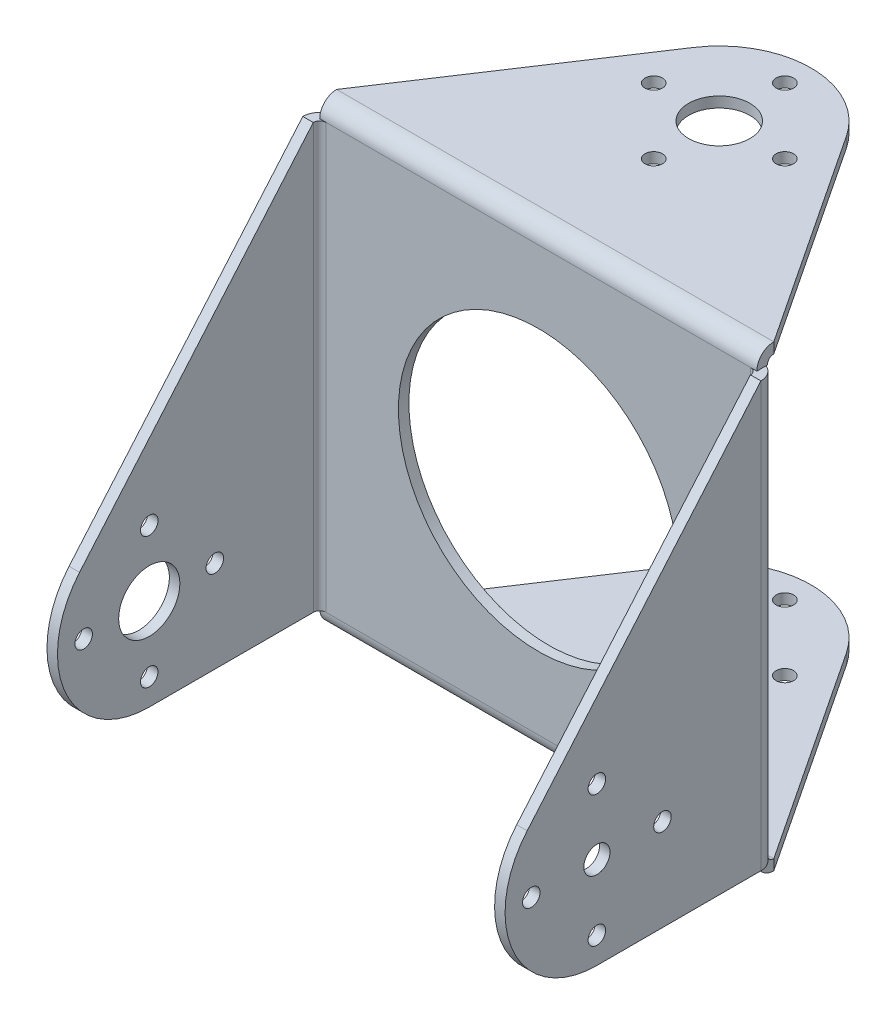
from build123d import *

# Parameters (mm, degrees)
SKETCH_1_W                         = 50
SKETCH_1_H                         = 50
SKETCH_1_R                         = 16
SM_BASE_FLANGE_1_DEPTH             = 1.2
SM_EDGE_FLANGE_1_STRIP_W           = 6.2732
SM_EDGE_FLANGE_1_STRIP_H           = 1.2
SM_EDGE_FLANGE_1_STRIP_CUT_DEPTH   = 50
SM_EDGE_FLANGE_1_STRIP_2_W         = 6.2732
SM_EDGE_FLANGE_1_STRIP_2_H         = 1.2
SM_EDGE_FLANGE_1_STRIP_CUT_2_DEPTH = 50
SM_EDGE_FLANGE_1_DEPTH             = 50
SM_EDGE_FLANGE_1_BEND_DEPTH        = 50
SM_EDGE_FLANGE_2_STRIP_W           = 6.2732
SM_EDGE_FLANGE_2_STRIP_H           = 1.2
SM_EDGE_FLANGE_2_STRIP_CUT_DEPTH   = 48.5268
SM_EDGE_FLANGE_2_STRIP_2_W         = 6.2732
SM_EDGE_FLANGE_2_STRIP_2_H         = 1.2
SM_EDGE_FLANGE_2_STRIP_CUT_2_DEPTH = 48.5268
SM_EDGE_FLANGE_2_DEPTH             = 48.5268
SM_EDGE_FLANGE_2_BEND_DEPTH        = 48.5268
SKETCH_23_R                        = 1
CUT_EXTRUDE_1_DEPTH                = 98
EXTRUDE_START                      = -1.2
SKETCH_30_R                        = 3.5
SKETCH_30_R_2                      = 1.5
EXTRUDE_1_DEPTH                    = 1.2
SKETCH_40_R                        = 1
CUT_EXTRUDE_2_DEPTH                = 67.374995292
SKETCH_40_3_R                      = 1.5
CUT_EXTRUDE_3_DEPTH                = 10
SKETCH_45_R                        = 3.5
CUT_EXTRUDE_4_DEPTH                = 10


# Sheet-metal steps are written as plain solids
with BuildPart() as part:
    # Sketch 1 → 基材-凸緣1 (new body)
    with BuildSketch(Plane.XY):
        Rectangle(SKETCH_1_W, SKETCH_1_H)
        Circle(SKETCH_1_R, mode=Mode.SUBTRACT)
    extrude(amount=-SM_BASE_FLANGE_1_DEPTH)

    # 邊線-凸緣1 strip (across the edge) → 邊線-凸緣1 strip cut (cut)
    with BuildSketch(Plane(origin=(-25, 25, -1.2), x_dir=(0, -1, 0), z_dir=(1, 0, 0))):
        with Locations((-2.4, -0.6)):
            Rectangle(SM_EDGE_FLANGE_1_STRIP_W, SM_EDGE_FLANGE_1_STRIP_H)
    extrude(amount=SM_EDGE_FLANGE_1_STRIP_CUT_DEPTH, mode=Mode.SUBTRACT)

    # 邊線-凸緣1 strip 2 (across the edge) → 邊線-凸緣1 strip cut 2 (cut)
    with BuildSketch(Plane(origin=(25, -25, -1.2), x_dir=(0, 1, 0), z_dir=(-1, 0, 0))):
        with Locations((-2.4, -0.6)):
            Rectangle(SM_EDGE_FLANGE_1_STRIP_2_W, SM_EDGE_FLANGE_1_STRIP_2_H)
    extrude(amount=SM_EDGE_FLANGE_1_STRIP_CUT_2_DEPTH, mode=Mode.SUBTRACT)

    # 邊線-凸緣1 section (across the edge) → 邊線-凸緣1 (add)
    with BuildSketch(Plane(origin=(-25, 25, -1.2), x_dir=(0, -1, 0), z_dir=(1, 0, 0))):
        with BuildLine():
            Line((-1.2, 0.7366), (-1.2, 30))
            Line((-1.2, 30), (0, 30))
            Line((0, 30), (0, 0.7366))
            ThreePointArc((0, 0.7366), (0.215745145, 0.215745145), (0.7366, 0))
            Line((0.7366, 0), (0.7366, -1.2))
            ThreePointArc((0.7366, -1.2), (-0.632782992, -0.632782992), (-1.2, 0.7366))
        make_face()
    extrude(amount=SM_EDGE_FLANGE_1_DEPTH)

    # 邊線-凸緣1 section 2 (across the edge) → 邊線-凸緣1 bend (add)
    with BuildSketch(Plane(origin=(25, -25, -1.2), x_dir=(0, 1, 0), z_dir=(-1, 0, 0))):
        with BuildLine():
            Line((-1.2, 0.7366), (-1.2, 30))
            Line((-1.2, 30), (0, 30))
            Line((0, 30), (0, 0.7366))
            ThreePointArc((0, 0.7366), (0.215745145, 0.215745145), (0.7366, 0))
            Line((0.7366, 0), (0.7366, -1.2))
            ThreePointArc((0.7366, -1.2), (-0.632782992, -0.632782992), (-1.2, 0.7366))
        make_face()
    extrude(amount=SM_EDGE_FLANGE_1_BEND_DEPTH)

    # 邊線-凸緣2 strip (across the edge) → 邊線-凸緣2 strip cut (cut)
    with BuildSketch(Plane(origin=(25, -24.2634, 0), x_dir=(-1, 0, 0), z_dir=(0, 1, 0))):
        with Locations((-2.4, -0.6)):
            Rectangle(SM_EDGE_FLANGE_2_STRIP_W, SM_EDGE_FLANGE_2_STRIP_H)
    extrude(amount=SM_EDGE_FLANGE_2_STRIP_CUT_DEPTH, mode=Mode.SUBTRACT)

    # 邊線-凸緣2 strip 2 (across the edge) → 邊線-凸緣2 strip cut 2 (cut)
    with BuildSketch(Plane(origin=(-25, 24.2634, 0), x_dir=(1, 0, 0), z_dir=(0, -1, 0))):
        with Locations((-2.4, -0.6)):
            Rectangle(SM_EDGE_FLANGE_2_STRIP_2_W, SM_EDGE_FLANGE_2_STRIP_2_H)
    extrude(amount=SM_EDGE_FLANGE_2_STRIP_CUT_2_DEPTH, mode=Mode.SUBTRACT)

    # 邊線-凸緣2 section (across the edge) → 邊線-凸緣2 (add)
    with BuildSketch(Plane(origin=(25, -24.2634, 0), x_dir=(-1, 0, 0), z_dir=(0, 1, 0))):
        with BuildLine():
            Line((-1.2, 0.7366), (-1.2, 30))
            Line((-1.2, 30), (0, 30))
            Line((0, 30), (0, 0.7366))
            ThreePointArc((0, 0.7366), (0.215745145, 0.215745145), (0.7366, 0))
            Line((0.7366, 0), (0.7366, -1.2))
            ThreePointArc((0.7366, -1.2), (-0.632782992, -0.632782992), (-1.2, 0.7366))
        make_face()
    extrude(amount=SM_EDGE_FLANGE_2_DEPTH)

    # 邊線-凸緣2 section 2 (across the edge) → 邊線-凸緣2 bend (add)
    with BuildSketch(Plane(origin=(-25, 24.2634, 0), x_dir=(1, 0, 0), z_dir=(0, -1, 0))):
        with BuildLine():
            Line((-1.2, 0.7366), (-1.2, 30))
            Line((-1.2, 30), (0, 30))
            Line((0, 30), (0, 0.7366))
            ThreePointArc((0, 0.7366), (0.215745145, 0.215745145), (0.7366, 0))
            Line((0.7366, 0), (0.7366, -1.2))
            ThreePointArc((0.7366, -1.2), (-0.632782992, -0.632782992), (-1.2, 0.7366))
        make_face()
    extrude(amount=SM_EDGE_FLANGE_2_BEND_DEPTH)

    # 草圖23 → 除料-伸長1 (cut)
    with BuildSketch(Plane(origin=(0, 26.2, 0), x_dir=(1, 0, 0), z_dir=(0, 1, 0))):
        with BuildLine():
            Line((25, 31.2), (0, 31.2))
            ThreePointArc((0, 31.2), (4.971280899, 29.948587256), (8.757585745, 26.492641186))
            Line((8.757585745, 26.492641186), (25, 1.9366))
            Line((25, 1.9366), (25, 31.2))
        make_face()
        with BuildLine():
            ThreePointArc((-8.757585745, 26.492641186), (-4.971280899, 29.948587256), (0, 31.2))
            Line((0, 31.2), (-25, 31.2))
            Line((-25, 31.2), (-25, 1.9366))
            Line((-25, 1.9366), (-8.757585745, 26.492641186))
        make_face()
        with BuildLine():
            ThreePointArc((1, 28.2), (0.707106781, 28.907106781), (0, 29.2))
            Line((0, 29.2), (0, 27.2))
            ThreePointArc((0, 27.2), (0.707106781, 27.492893219), (1, 28.2))
        make_face()
        with BuildLine():
            Line((0, 27.2), (0, 29.2))
            ThreePointArc((0, 29.2), (-1, 28.2), (0, 27.2))
        make_face()
        with Locations(Location((-7.5, 20.7, 0), (0, 0, 90))):
            Circle(SKETCH_23_R)
        with Locations(Location((7.5, 20.7, 0), (0, 0, 90))):
            Circle(SKETCH_23_R)
        with BuildLine():
            ThreePointArc((1, 13.2), (0.707106781, 13.907106781), (0, 14.2))
            Line((0, 14.2), (0, 12.2))
            ThreePointArc((0, 12.2), (0.707106781, 12.492893219), (1, 13.2))
        make_face()
        with BuildLine():
            Line((0, 12.2), (0, 14.2))
            ThreePointArc((0, 14.2), (-1, 13.2), (0, 12.2))
        make_face()
        with BuildLine():
            ThreePointArc((3.5, 20.7), (2.474873734, 23.174873734), (0, 24.2))
            Line((0, 24.2), (0, 17.2))
            ThreePointArc((0, 17.2), (2.474873734, 18.225126266), (3.5, 20.7))
        make_face()
        with BuildLine():
            Line((0, 17.2), (0, 24.2))
            ThreePointArc((0, 24.2), (-3.5, 20.7), (0, 17.2))
        make_face()
    extrude(amount=-CUT_EXTRUDE_1_DEPTH, mode=Mode.SUBTRACT)

    # 草圖30 → 填料-伸長1 (add)
    with BuildSketch(Plane.XZ.offset(26.2).offset(EXTRUDE_START)):
        with Locations(Location((0, -20.7, 0), (0, 0, 270))):
            Circle(SKETCH_30_R)
        with Locations(Location((0, -20.7, 0), (0, 0, 270))):
            Circle(SKETCH_30_R_2, mode=Mode.SUBTRACT)
    extrude(amount=EXTRUDE_1_DEPTH)

    # 草圖40 → 除料-伸長2 (cut, through all)
    with BuildSketch(Plane(origin=(26.2, 0, 0), x_dir=(0, 0, -1), z_dir=(1, 0, 0))):
        with BuildLine():
            Line((-27.472406899, -6.93033859), (-0.7366, 24.2634))
            Line((-0.7366, 24.2634), (-30, 24.2634))
            Line((-30, 24.2634), (-30, -13.763399983))
            ThreePointArc((-30, -13.763399983), (-29.347849317, -10.12061757), (-27.472406899, -6.93033859))
        make_face()
        with BuildLine():
            ThreePointArc((-19.5, -24.2634), (-26.924621208, -21.188021196), (-30, -13.763399983))
            Line((-30, -13.763399983), (-30, -24.2634))
            Line((-30, -24.2634), (-19.5, -24.2634))
        make_face()
        with Locations(Location((-19.5, -6.2634, 0), (0, 0, 180))):
            Circle(SKETCH_40_R)
        with Locations(Location((-12, -13.7634, 0), (0, 0, 180))):
            Circle(SKETCH_40_R)
        with Locations(Location((-19.5, -21.2634, 0), (0, 0, 180))):
            Circle(SKETCH_40_R)
        with Locations(Location((-27, -13.7634, 0), (0, 0, 180))):
            Circle(SKETCH_40_R)
    extrude(amount=-CUT_EXTRUDE_2_DEPTH, mode=Mode.SUBTRACT)

    # 草圖40<3> → 除料-伸長3 (cut)
    with BuildSketch(Plane(origin=(26.2, 0, 0), x_dir=(0, 0, -1), z_dir=(1, 0, 0))):
        with Locations((-19.5, -13.7634)):
            Circle(SKETCH_40_3_R)
    extrude(amount=-CUT_EXTRUDE_3_DEPTH, mode=Mode.SUBTRACT)

    # 草圖45 → 除料-伸長4 (cut)
    with BuildSketch(Plane.ZY.offset(26.2)):
        with Locations((19.5, -13.7634)):
            Circle(SKETCH_45_R)
    extrude(amount=-CUT_EXTRUDE_4_DEPTH, mode=Mode.SUBTRACT)


solid = part.part
